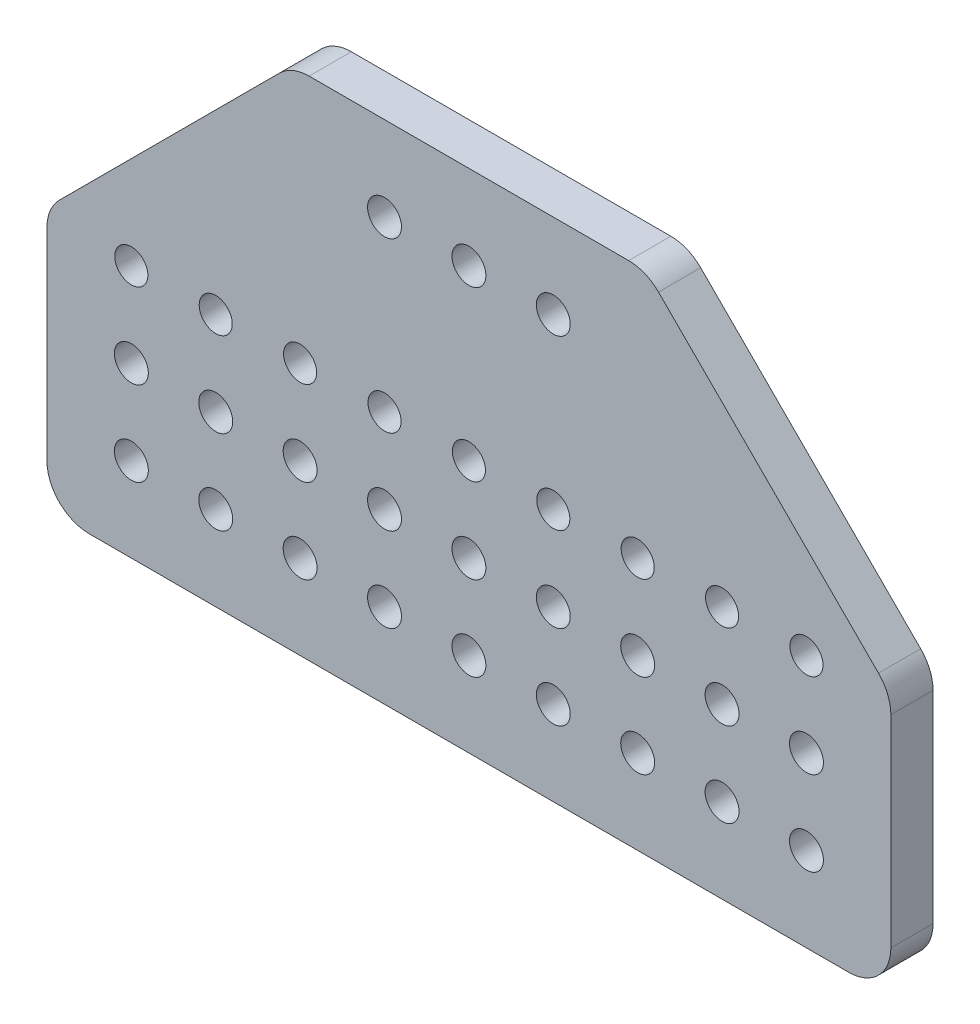
from build123d import *

# Parameters (mm, degrees)
SKETCH1_W               = 127
SKETCH1_H               = 82.55
BOSS_EXTRUDE1_DEPTH     = 6.35
CUT_EXTRUDE1_DEPTH      = 152.604172106
CUT_EXTRUDE1_DEPTH_BACK = 152.604172106
SKETCH2_R               = 2.5527
SKETCH3_R               = 2.4892
SKETCH3_R_2             = 2.5527
CUT_EXTRUDE2_DEPTH      = 152.604172106
CUT_EXTRUDE3_DEPTH      = 152.604172106
CUT_EXTRUDE4_DEPTH      = 152.604172106
FILLET1_R               = 6.35


with BuildPart() as part:
    # Sketch1 → Boss-Extrude1 (new body)
    with BuildSketch(Plane.XY):
        with Locations((63.5, 41.275)):
            Rectangle(SKETCH1_W, SKETCH1_H)
    extrude(amount=BOSS_EXTRUDE1_DEPTH)

    # Sketch2 → Cut-Extrude1 (cut, two sides: drawn at the far end of the back side and taken through both)
    with BuildSketch(Plane(origin=(0, 0, 0), x_dir=(-1, 0, 0), z_dir=(0, 0, -1)).offset(-CUT_EXTRUDE1_DEPTH_BACK)):
        with Locations((-76.2, 63.5)):
            Circle(SKETCH2_R)
        with Locations((-63.5, 63.5)):
            Circle(SKETCH2_R)
        with Locations((-50.8, 63.5)):
            Circle(SKETCH2_R)
    extrude(amount=CUT_EXTRUDE1_DEPTH + CUT_EXTRUDE1_DEPTH_BACK, mode=Mode.SUBTRACT)

    # Sketch3 → Cut-Extrude2 (cut, through all)
    with BuildSketch(Plane(origin=(0, 0, 0), x_dir=(-1, 0, 0), z_dir=(0, 0, -1))):
        with Locations((-114.3, 38.1)):
            Circle(SKETCH3_R)
        with Locations((-114.3, 25.4)):
            Circle(SKETCH3_R_2)
        with Locations((-114.3, 12.7)):
            Circle(SKETCH3_R_2)
        with Locations((-101.6, 38.1)):
            Circle(SKETCH3_R)
        with Locations((-101.6, 25.4)):
            Circle(SKETCH3_R_2)
        with Locations((-101.6, 12.7)):
            Circle(SKETCH3_R_2)
        with Locations((-88.9, 38.1)):
            Circle(SKETCH3_R)
        with Locations((-88.9, 25.4)):
            Circle(SKETCH3_R_2)
        with Locations((-88.9, 12.7)):
            Circle(SKETCH3_R_2)
        with Locations((-76.2, 38.1)):
            Circle(SKETCH3_R)
        with Locations((-76.2, 25.4)):
            Circle(SKETCH3_R_2)
        with Locations((-76.2, 12.7)):
            Circle(SKETCH3_R_2)
        with Locations((-63.5, 38.1)):
            Circle(SKETCH3_R)
        with Locations((-63.5, 25.4)):
            Circle(SKETCH3_R_2)
        with Locations((-63.5, 12.7)):
            Circle(SKETCH3_R_2)
        with Locations((-50.8, 38.1)):
            Circle(SKETCH3_R)
        with Locations((-50.8, 25.4)):
            Circle(SKETCH3_R_2)
        with Locations((-50.8, 12.7)):
            Circle(SKETCH3_R_2)
        with Locations((-38.1, 38.1)):
            Circle(SKETCH3_R)
        with Locations((-38.1, 25.4)):
            Circle(SKETCH3_R_2)
        with Locations((-38.1, 12.7)):
            Circle(SKETCH3_R_2)
        with Locations((-25.4, 38.1)):
            Circle(SKETCH3_R)
        with Locations((-25.4, 25.4)):
            Circle(SKETCH3_R_2)
        with Locations((-25.4, 12.7)):
            Circle(SKETCH3_R_2)
        with Locations((-12.7, 38.1)):
            Circle(SKETCH3_R)
        with Locations((-12.7, 25.4)):
            Circle(SKETCH3_R_2)
        with Locations((-12.7, 12.7)):
            Circle(SKETCH3_R_2)
    extrude(amount=-CUT_EXTRUDE2_DEPTH, mode=Mode.SUBTRACT)

    # Sketch4 → Cut-Extrude3 (cut, through all)
    with BuildSketch(Plane(origin=(0, 0, 0), x_dir=(-1, 0, 0), z_dir=(0, 0, -1))):
        Polygon((-83.82, 82.55), (-127, 39.37), (-127, 82.55), align=None)
        Polygon((-43.18, 82.55), (0, 82.55), (0, 39.37), align=None)
    extrude(amount=-CUT_EXTRUDE3_DEPTH, mode=Mode.SUBTRACT)

    # Sketch5 → Cut-Extrude4 (cut, through all)
    with BuildSketch(Plane(origin=(0, 0, 0), x_dir=(-1, 0, 0), z_dir=(0, 0, -1))):
        Polygon((-90.17, 76.2), (-36.83, 76.2), (-43.18, 82.55), (-83.82, 82.55), align=None)
    extrude(amount=-CUT_EXTRUDE4_DEPTH, mode=Mode.SUBTRACT)

    # Fillet1
    fillet1_edges = [part.edges().sort_by_distance(p)[0] for p in [
        (127, 39.37, 3.175),
        (127, 0, 3.175),
        (0, 0, 3.175),
        (36.83, 76.2, 3.175),
        (90.17, 76.2, 3.175),
        (0, 39.37, 3.175),
    ]]
    fillet(fillet1_edges, radius=FILLET1_R)


solid = part.part
